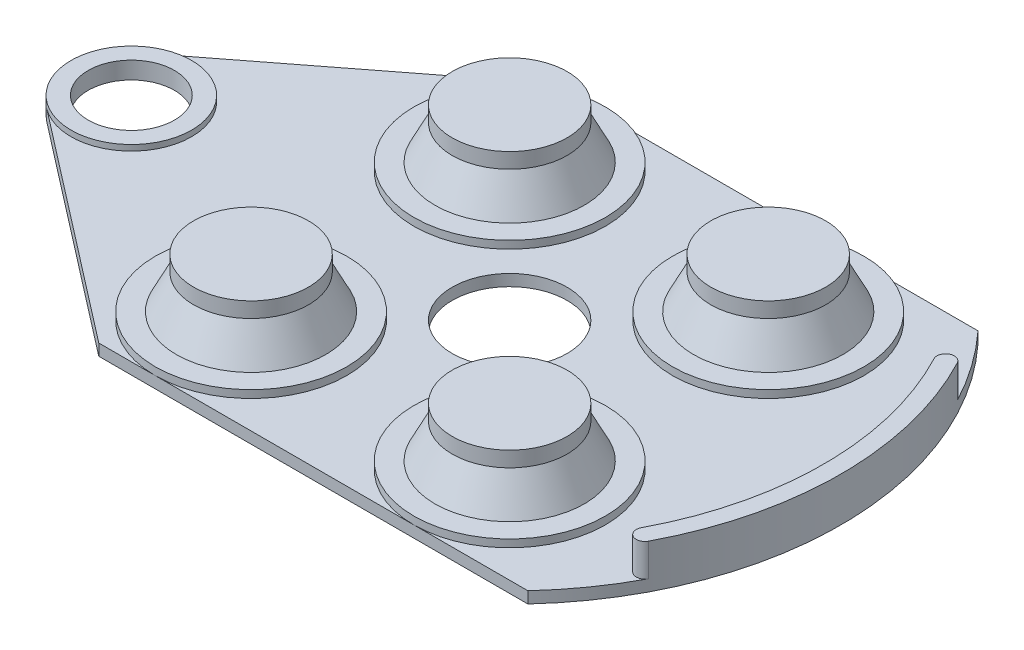
from build123d import *

# Parameters (mm, degrees)
ESQUISSE1_R             = 3
SUPPORT_DEPTH           = 0.6
ESQUISSE1_4_R           = 2.25
FIXATION_DEPTH          = 0.9
LANGUETTE_DEPTH         = 2.3
ESQUISSE2_R             = 5
ESQUISSE2_R_2           = 4
SEMELLE_DEPTH           = 0.4
ESQUISSE2_4_R           = 3
BOUTONS_DEPTH           = 3
ESQUISSE2_5_R           = 4
ESQUISSE2_5_R_2         = 3
BORDURE_DEPTH           = 2.2
CHANFREIN_SIZE          = 2
CHANFREIN_SIZE_2        = 1
ESQUISSE3_R             = 2.4
ENL_V_MAT_EXTRU_1_DEPTH = 0.01


with BuildPart() as part:
    # Esquisse1 → Support (new body)
    with BuildSketch(Plane(origin=(0, 0, 0), x_dir=(1, 0, 0), z_dir=(0, 1, 0))):
        with BuildLine():
            Line((12.7, 11.75), (-9.7, 11.75))
            Line((-9.7, 11.75), (-21.676479721, 2.492223081))
            ThreePointArc((-21.676479721, 2.492223081), (-18.361819738, 2.82762366), (-16.6, 0))
            ThreePointArc((-16.6, 0), (-18.361819738, -2.82762366), (-21.676479721, -2.492223081))
            Line((-21.676479721, -2.492223081), (-9.7, -11.75))
            Line((-9.7, -11.75), (12.7, -11.75))
            ThreePointArc((12.7, -11.75), (14.125401288, -9.990303879), (15.308839134, -8.059559428))
            ThreePointArc((15.308839134, -8.059559428), (14.701052578, -8.248227129), (14.512384877, -7.640440572))
            ThreePointArc((14.512384877, -7.640440572), (16.4, 0), (14.512384877, 7.640440572))
            ThreePointArc((14.512384877, 7.640440572), (14.701052578, 8.248227129), (15.308839134, 8.059559428))
            ThreePointArc((15.308839134, 8.059559428), (14.125401288, 9.990303879), (12.7, 11.75))
        make_face()
        with Locations(Location((0, 0, 0), (0, 0, 270))):
            Circle(ESQUISSE1_R, mode=Mode.SUBTRACT)
    extrude(amount=SUPPORT_DEPTH)

    # Esquisse1<4> → Fixation (add)
    with BuildSketch(Plane(origin=(0, 0, 0), x_dir=(1, 0, 0), z_dir=(0, 1, 0))):
        with BuildLine():
            ThreePointArc((-16.6, 0), (-18.361819738, 2.82762366), (-21.676479721, 2.492223081))
            ThreePointArc((-21.676479721, 2.492223081), (-22.9, 0), (-21.676479721, -2.492223081))
            ThreePointArc((-21.676479721, -2.492223081), (-18.361819738, -2.82762366), (-16.6, 0))
        make_face()
        with Locations(Location((-19.75, 0, 0), (0, 0, 270))):
            Circle(ESQUISSE1_4_R, mode=Mode.SUBTRACT)
    extrude(amount=FIXATION_DEPTH)

    # Esquisse1<5> → Languette (add)
    with BuildSketch(Plane(origin=(0, 0, 0), x_dir=(1, 0, 0), z_dir=(0, 1, 0))):
        with BuildLine():
            ThreePointArc((15.308839134, -8.059559428), (17.3, 0), (15.308839134, 8.059559428))
            ThreePointArc((15.308839134, 8.059559428), (14.701052578, 8.248227129), (14.512384877, 7.640440572))
            ThreePointArc((14.512384877, 7.640440572), (16.4, 0), (14.512384877, -7.640440572))
            ThreePointArc((14.512384877, -7.640440572), (14.701052578, -8.248227129), (15.308839134, -8.059559428))
        make_face()
    extrude(amount=LANGUETTE_DEPTH)

    # Esquisse2 → Semelle (add)
    # profile 1 of 4: a face of its own
    with BuildSketch(Plane(origin=(0, 0.6, 0), x_dir=(1, 0, 0), z_dir=(0, 1, 0))):
        with Locations(Location((-6.75, 6.75, 0), (0, 0, 90))):
            Circle(ESQUISSE2_R)
        with Locations(Location((-6.75, 6.75, 0), (0, 0, 270))):
            Circle(ESQUISSE2_R_2, mode=Mode.SUBTRACT)
    # profile 2 of 4: a face of its own
    with BuildSketch(Plane(origin=(0, 0.6, 0), x_dir=(1, 0, 0), z_dir=(0, 1, 0))):
        with Locations(Location((6.75, 6.75, 0), (0, 0, 90))):
            Circle(ESQUISSE2_R)
        with Locations(Location((6.75, 6.75, 0), (0, 0, 270))):
            Circle(ESQUISSE2_R_2, mode=Mode.SUBTRACT)
    # profile 3 of 4: a face of its own
    with BuildSketch(Plane(origin=(0, 0.6, 0), x_dir=(1, 0, 0), z_dir=(0, 1, 0))):
        with Locations(Location((6.75, -6.75, 0), (0, 0, 270))):
            Circle(ESQUISSE2_R)
        with Locations(Location((6.75, -6.75, 0), (0, 0, 270))):
            Circle(ESQUISSE2_R_2, mode=Mode.SUBTRACT)
    # profile 4 of 4: a face of its own
    with BuildSketch(Plane(origin=(0, 0.6, 0), x_dir=(1, 0, 0), z_dir=(0, 1, 0))):
        with Locations(Location((-6.75, -6.75, 0), (0, 0, 270))):
            Circle(ESQUISSE2_R)
        with Locations(Location((-6.75, -6.75, 0), (0, 0, 270))):
            Circle(ESQUISSE2_R_2, mode=Mode.SUBTRACT)
    extrude(amount=SEMELLE_DEPTH)

    # Esquisse2<4> → Boutons (add)
    with BuildSketch(Plane(origin=(0, 0.6, 0), x_dir=(1, 0, 0), z_dir=(0, 1, 0))):
        with Locations(Location((-6.75, 6.75, 0), (0, 0, 270))):
            Circle(ESQUISSE2_4_R)
        with Locations(Location((6.75, 6.75, 0), (0, 0, 270))):
            Circle(ESQUISSE2_4_R)
        with Locations(Location((6.75, -6.75, 0), (0, 0, 270))):
            Circle(ESQUISSE2_4_R)
        with Locations(Location((-6.75, -6.75, 0), (0, 0, 270))):
            Circle(ESQUISSE2_4_R)
    extrude(amount=BOUTONS_DEPTH)

    # Esquisse2<5> → Bordure (add)
    # profile 1 of 4: a face of its own
    with BuildSketch(Plane(origin=(0, 0.6, 0), x_dir=(1, 0, 0), z_dir=(0, 1, 0))):
        with Locations(Location((-6.75, 6.75, 0), (0, 0, 270))):
            Circle(ESQUISSE2_5_R)
        with Locations(Location((-6.75, 6.75, 0), (0, 0, 270))):
            Circle(ESQUISSE2_5_R_2, mode=Mode.SUBTRACT)
    # profile 2 of 4: a face of its own
    with BuildSketch(Plane(origin=(0, 0.6, 0), x_dir=(1, 0, 0), z_dir=(0, 1, 0))):
        with Locations(Location((6.75, 6.75, 0), (0, 0, 270))):
            Circle(ESQUISSE2_5_R)
        with Locations(Location((6.75, 6.75, 0), (0, 0, 270))):
            Circle(ESQUISSE2_5_R_2, mode=Mode.SUBTRACT)
    # profile 3 of 4: a face of its own
    with BuildSketch(Plane(origin=(0, 0.6, 0), x_dir=(1, 0, 0), z_dir=(0, 1, 0))):
        with Locations(Location((-6.75, -6.75, 0), (0, 0, 270))):
            Circle(ESQUISSE2_5_R)
        with Locations(Location((-6.75, -6.75, 0), (0, 0, 270))):
            Circle(ESQUISSE2_5_R_2, mode=Mode.SUBTRACT)
    # profile 4 of 4: a face of its own
    with BuildSketch(Plane(origin=(0, 0.6, 0), x_dir=(1, 0, 0), z_dir=(0, 1, 0))):
        with Locations(Location((6.75, -6.75, 0), (0, 0, 270))):
            Circle(ESQUISSE2_5_R)
        with Locations(Location((6.75, -6.75, 0), (0, 0, 270))):
            Circle(ESQUISSE2_5_R_2, mode=Mode.SUBTRACT)
    extrude(amount=BORDURE_DEPTH)

    # Chanfrein
    # the kernel refuses this chamfer: 2, 1 mm, written as the material it takes off along each edge
    with BuildSketch(Plane(origin=(6.75, 2.8, -6.75), x_dir=(0, 0, 1), z_dir=(-1, 0, 0))) as chanfrein_piece_1_section:
        Polygon((4, -CHANFREIN_SIZE), (4 - CHANFREIN_SIZE_2, 0), (4, 0), align=None)
    chanfrein_piece_1 = revolve(axis=Axis((6.75, 2.8, -6.75), (0, 1, 0)), mode=Mode.PRIVATE)
    chanfrein_piece_1 = split(chanfrein_piece_1, bisect_by=Plane(origin=(6.75, 1, -10.226430856), z_dir=(0, 1, 0)), keep=Keep.TOP, mode=Mode.PRIVATE)
    chanfrein_piece_1 = chanfrein_piece_1 - Plane(origin=(6.75, 1.913215428, -6.75), x_dir=(0, 0, 1), z_dir=(0, -1, 0)) * Cylinder(3, 16, mode=Mode.PRIVATE)
    add(chanfrein_piece_1, mode=Mode.SUBTRACT)
    with BuildSketch(Plane(origin=(6.75, 2.8, 6.75), x_dir=(0, 0, 1), z_dir=(-1, 0, 0))) as chanfrein_piece_2_section:
        Polygon((4, -CHANFREIN_SIZE), (4 - CHANFREIN_SIZE_2, 0), (4, 0), align=None)
    chanfrein_piece_2 = revolve(axis=Axis((6.75, 2.8, 6.75), (0, 1, 0)), mode=Mode.PRIVATE)
    chanfrein_piece_2 = split(chanfrein_piece_2, bisect_by=Plane(origin=(6.75, 1, 3.273569144), z_dir=(0, 1, 0)), keep=Keep.TOP, mode=Mode.PRIVATE)
    chanfrein_piece_2 = chanfrein_piece_2 - Plane(origin=(6.75, 1.913215428, 6.75), x_dir=(0, 0, 1), z_dir=(0, -1, 0)) * Cylinder(3, 16, mode=Mode.PRIVATE)
    add(chanfrein_piece_2, mode=Mode.SUBTRACT)
    with BuildSketch(Plane(origin=(-6.75, 2.8, 6.75), x_dir=(0, 0, 1), z_dir=(-1, 0, 0))) as chanfrein_piece_3_section:
        Polygon((4, -CHANFREIN_SIZE), (4 - CHANFREIN_SIZE_2, 0), (4, 0), align=None)
    chanfrein_piece_3 = revolve(axis=Axis((-6.75, 2.8, 6.75), (0, 1, 0)), mode=Mode.PRIVATE)
    chanfrein_piece_3 = split(chanfrein_piece_3, bisect_by=Plane(origin=(-6.75, 1, 3.273569144), z_dir=(0, 1, 0)), keep=Keep.TOP, mode=Mode.PRIVATE)
    chanfrein_piece_3 = chanfrein_piece_3 - Plane(origin=(-6.75, 1.913215428, 6.75), x_dir=(0, 0, 1), z_dir=(0, -1, 0)) * Cylinder(3, 16, mode=Mode.PRIVATE)
    add(chanfrein_piece_3, mode=Mode.SUBTRACT)
    with BuildSketch(Plane(origin=(-6.75, 2.8, -6.75), x_dir=(0, 0, 1), z_dir=(-1, 0, 0))) as chanfrein_piece_4_section:
        Polygon((4, -CHANFREIN_SIZE), (4 - CHANFREIN_SIZE_2, 0), (4, 0), align=None)
    chanfrein_piece_4 = revolve(axis=Axis((-6.75, 2.8, -6.75), (0, 1, 0)), mode=Mode.PRIVATE)
    chanfrein_piece_4 = split(chanfrein_piece_4, bisect_by=Plane(origin=(-6.75, 1, -10.226430856), z_dir=(0, 1, 0)), keep=Keep.TOP, mode=Mode.PRIVATE)
    chanfrein_piece_4 = chanfrein_piece_4 - Plane(origin=(-6.75, 1.913215428, -6.75), x_dir=(0, 0, 1), z_dir=(0, -1, 0)) * Cylinder(3, 16, mode=Mode.PRIVATE)
    add(chanfrein_piece_4, mode=Mode.SUBTRACT)

    # Esquisse3 → Enlèv. mat.-Extru.1 (cut)
    with BuildSketch(Plane.XZ):
        with Locations(Location((6.75, -6.75, 0), (0, 0, 270))):
            Circle(ESQUISSE3_R)
        with Locations(Location((-6.75, -6.75, 0), (0, 0, 270))):
            Circle(ESQUISSE3_R)
        with Locations(Location((6.75, 6.75, 0), (0, 0, 270))):
            Circle(ESQUISSE3_R)
        with Locations(Location((-6.75, 6.75, 0), (0, 0, 270))):
            Circle(ESQUISSE3_R)
    extrude(amount=-ENL_V_MAT_EXTRU_1_DEPTH, mode=Mode.SUBTRACT)


solid = part.part
